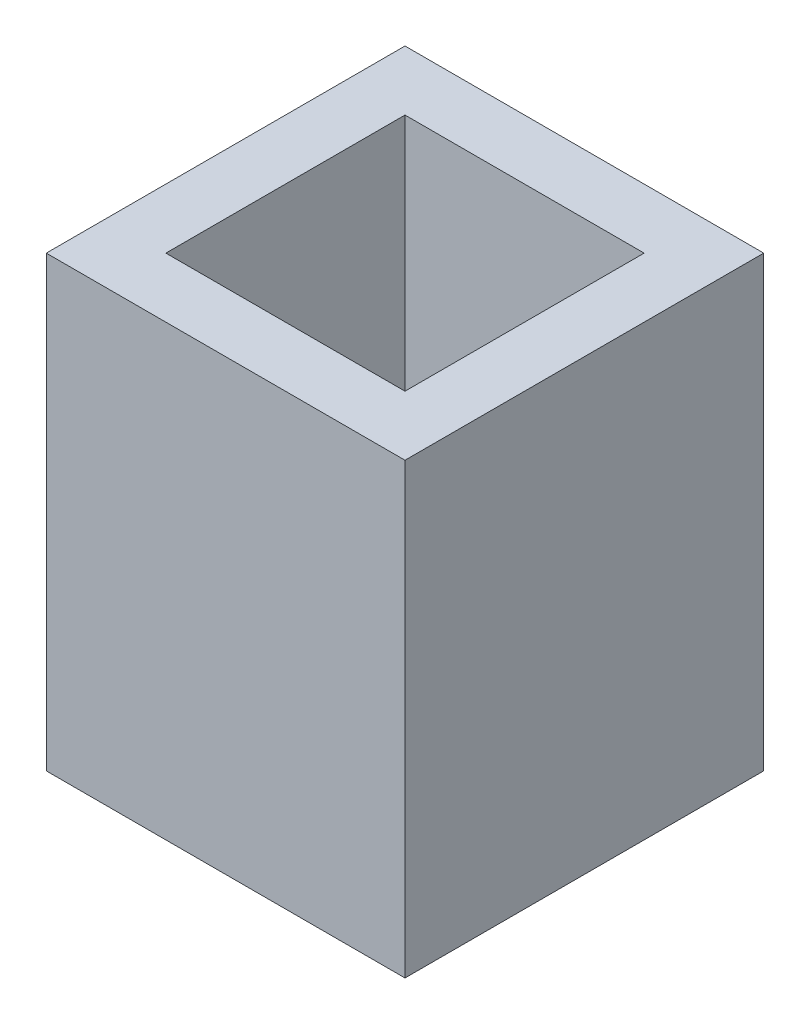
from build123d import *

# Parameters (mm, degrees)
SKETCH_1_W      = 16
SKETCH_1_H      = 16
EXTRUDE_1_DEPTH = 30


with BuildPart() as part:
    # 草图1 → 凸台-拉伸1 (new body)
    with BuildSketch(Plane(origin=(0, 0, 0), x_dir=(1, 0, 0), z_dir=(0, 1, 0))):
        Polygon((0, 20), (0, 0), (20, 0), (24, 0), (24, 24), (0, 24), align=None)
        with Locations((12, 12)):
            Rectangle(SKETCH_1_W, SKETCH_1_H, mode=Mode.SUBTRACT)
    extrude(amount=EXTRUDE_1_DEPTH)


solid = part.part
